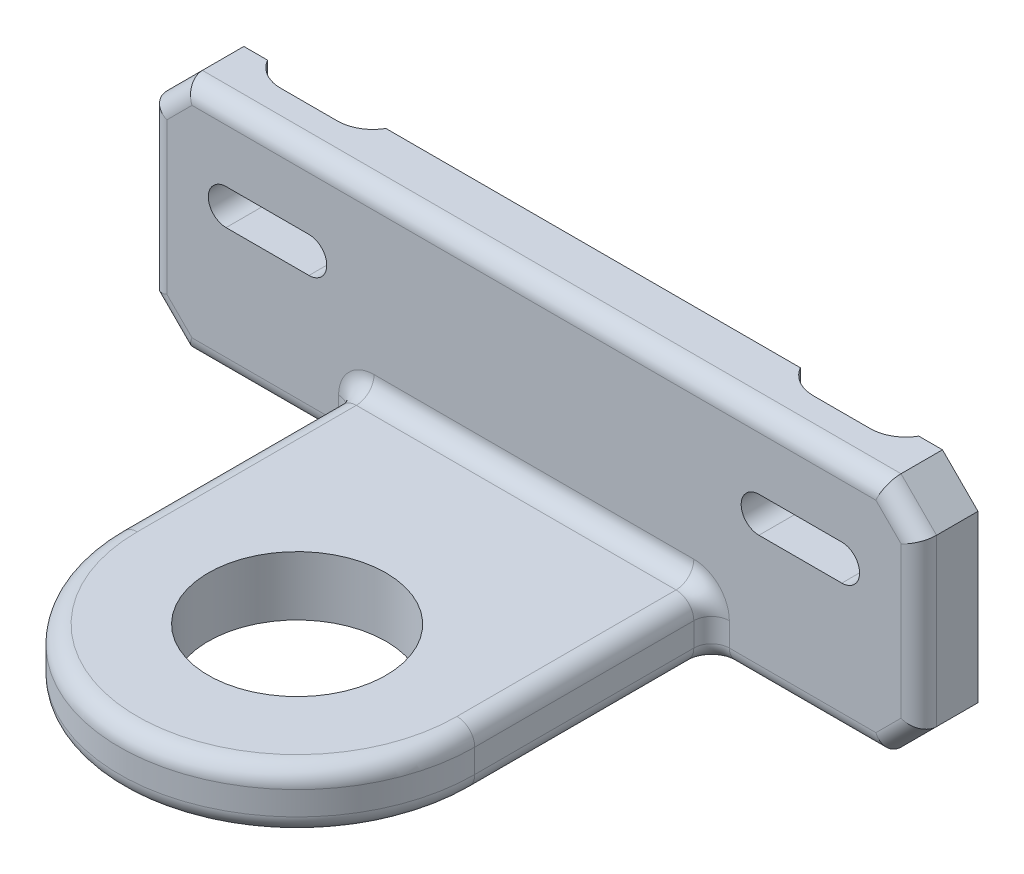
from build123d import *

# Parameters (mm, degrees)
ESQUISSE1_W             = 130
ESQUISSE1_H             = 40
BOSS_EXTRU_1_DEPTH      = 10
ESQUISSE2_R             = 15
BOSS_EXTRU_2_DEPTH      = 10
ENL_V_MAT_EXTRU_1_DEPTH = 98.59610648
ESQUISSE4_W             = 20
ESQUISSE4_H             = 3
ENL_V_MAT_EXTRU_2_DEPTH = 111.566721937
CONG_5_START            = -20
CONG_5_DEPTH            = 40
CONG_5_START_2          = -4.421e-06
CONG_5_2_DEPTH          = 3.000004421
CHANFREIN1_SIZE         = 6
CONG_6_R                = 3


with BuildPart() as part:
    # Esquisse1 → Boss.-Extru.1 (new body)
    with BuildSketch(Plane.XY):
        Rectangle(ESQUISSE1_W, ESQUISSE1_H)
    extrude(amount=BOSS_EXTRU_1_DEPTH)

    # Esquisse2 → Boss.-Extru.2 (add)
    with BuildSketch(Plane.XZ.offset(20)):
        with BuildLine():
            Line((-30, 0), (-30, 50))
            ThreePointArc((-30, 50), (0, 80), (30, 50))
            Line((30, 50), (30, 0))
            Line((30, 0), (-30, 0))
        make_face()
        with Locations(Location((0, 50, 0), (0, 0, 270))):
            Circle(ESQUISSE2_R, mode=Mode.SUBTRACT)
    extrude(amount=-BOSS_EXTRU_2_DEPTH)

    # Esquisse3 → Enlèv. mat.-Extru.1 (cut, through all)
    with BuildSketch(Plane.XY.offset(10)):
        with BuildLine():
            Line((38, 8), (52, 8))
            ThreePointArc((52, 8), (55, 5), (52, 2))
            Line((52, 2), (38, 2))
            ThreePointArc((38, 2), (35, 5), (38, 8))
        make_face()
    enl_v_mat_extru_1 = extrude(amount=-ENL_V_MAT_EXTRU_1_DEPTH, mode=Mode.SUBTRACT)

    # Symétrie1: Enlèv. mat.-Extru.1 across plane
    add(enl_v_mat_extru_1.mirror(Plane(origin=(0, 0, 0), x_dir=(0, 0, 1), z_dir=(1, 0, 0))), mode=Mode.SUBTRACT)

    # Esquisse4 → Enlèv. mat.-Extru.2 (cut, through all)
    with BuildSketch(Plane(origin=(0, 20, 0), x_dir=(1, 0, 0), z_dir=(0, 1, 0))):
        with Locations((45, -1.5)):
            Rectangle(ESQUISSE4_W, ESQUISSE4_H)
    enl_v_mat_extru_2 = extrude(amount=-ENL_V_MAT_EXTRU_2_DEPTH, mode=Mode.SUBTRACT)

    # Congé5: read off the stored shape, not the designer's step
    # Congé5 outline → Congé5 (add)
    with BuildSketch(Plane(origin=(0, 0, 0), x_dir=(1, 0, 0), z_dir=(0, 1, 0)).offset(CONG_5_START)):
        with BuildLine():
            Line((55, -3), (55.000002552, 4.421e-06))
            ThreePointArc((55.000002552, 4.421e-06), (52.803849788, -2.196151147), (49.803847577, -3))
            Line((49.803847577, -3), (55, -3))
        make_face()
        with BuildLine():
            Line((35, -3), (40.196152423, -3))
            ThreePointArc((40.196152423, -3), (37.196152423, -2.196152423), (35, 0))
            Line((35, 0), (35, -3))
        make_face()
    cong_5 = extrude(amount=CONG_5_DEPTH)

    # Cong_5 2 outline → Cong_5 2 (cut)
    with BuildSketch(Plane.XY.offset(CONG_5_START_2)):
        with BuildLine():
            Line((52, 8), (38, 8))
            ThreePointArc((38, 8), (35, 5), (38, 2))
            Line((38, 2), (52, 2))
            ThreePointArc((52, 2), (55, 5), (52, 8))
        make_face()
    cong_5_2 = extrude(amount=CONG_5_2_DEPTH, mode=Mode.SUBTRACT)

    # Symétrie2: Enlèv. mat.-Extru.2, Congé5, Cong_5 2 across plane
    add(enl_v_mat_extru_2.mirror(Plane(origin=(0, 0, 0), x_dir=(0, 0, 1), z_dir=(1, 0, 0))), mode=Mode.SUBTRACT)
    add(cong_5.mirror(Plane(origin=(0, 0, 0), x_dir=(0, 0, 1), z_dir=(1, 0, 0))))
    add(cong_5_2.mirror(Plane(origin=(0, 0, 0), x_dir=(0, 0, 1), z_dir=(1, 0, 0))), mode=Mode.SUBTRACT)

    # Chanfrein1
    chanfrein1_edges = [part.edges().sort_by_distance(p)[0] for p in [
        (65, -20, 5),
        (-65, -20, 5),
        (-65, 20, 5),
        (65, 20, 5),
    ]]
    chamfer(chanfrein1_edges, length=CHANFREIN1_SIZE)

    # Congé6
    cong_6_edges = [part.edges().sort_by_distance(p)[0] for p in [
        (44.5, -20, 10),
        (65, 0, 10),
        (-44.5, -20, 10),
        (0, 20, 10),
        (-65, 0, 10),
        (-62, 17, 10),
        (62, 17, 10),
        (-62, -17, 10),
        (62, -17, 10),
        (-30, -10, 30),
        (-30, -15, 10),
        (0, -10, 80),
        (30, -15, 10),
        (30, -10, 30),
        (0, -10, 10),
        (30, -20, 30),
        (0, -20, 80),
        (-30, -20, 30),
    ]]
    fillet(cong_6_edges, radius=CONG_6_R)


solid = part.part
